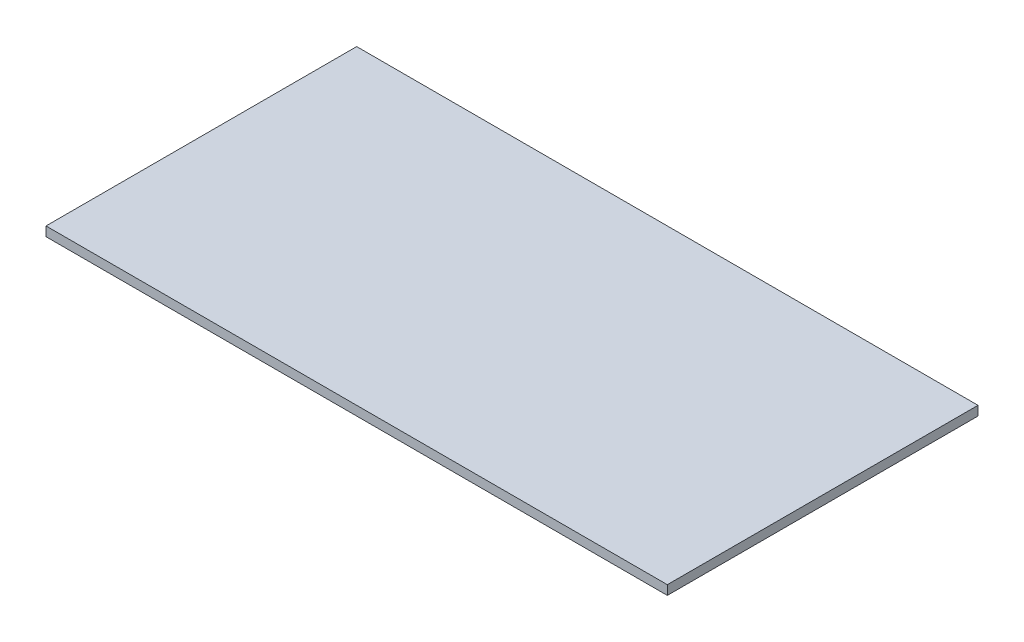
from build123d import *

# Parameters (mm, degrees)
SKETCH_1_W      = 200
SKETCH_1_H      = 100
ABOT_BASE_DEPTH = 3


with BuildPart() as part:
    # Эскиз1 → abot_base (new body)
    with BuildSketch(Plane(origin=(0, 0, 0), x_dir=(1, 0, 0), z_dir=(0, 1, 0))):
        Rectangle(SKETCH_1_W, SKETCH_1_H)
    extrude(amount=ABOT_BASE_DEPTH)


solid = part.part
